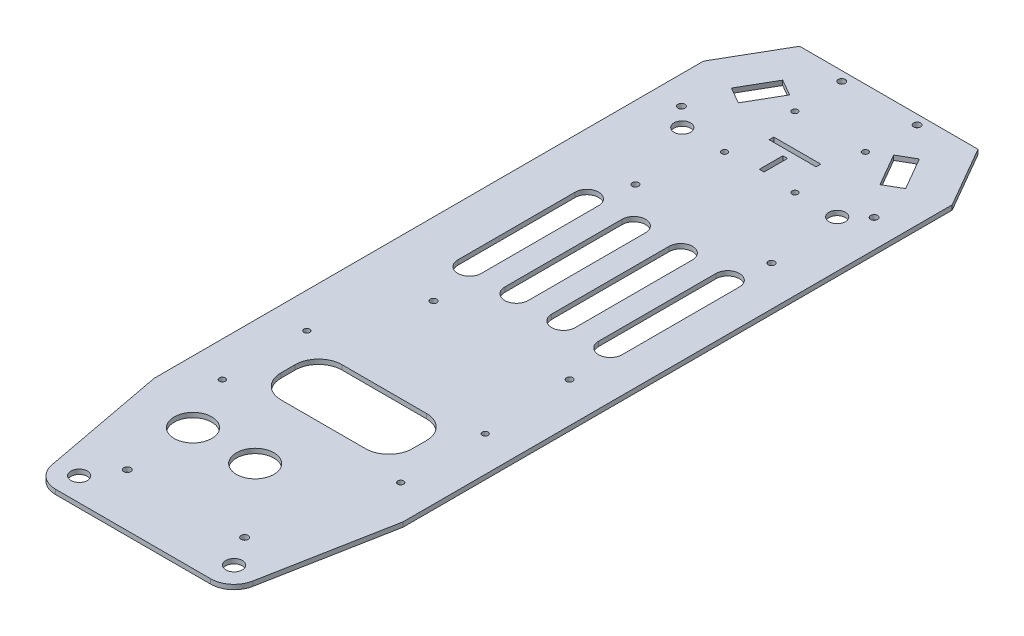
from build123d import *

# Parameters (mm, degrees)
ESQUISSE1_W              = 106
ESQUISSE1_H              = 332
ESQUISSE1_R              = 3.5
BOSS_EXTRU_1_DEPTH       = 2
ESQUISSE3_R              = 1.375
ENL_V_MAT_EXTRU_1_DEPTH  = 192.01112533
CHANFREIN1_SIZE          = 15
CHANFREIN1_SIZE2         = 25.980762114
ESQUISSE4_R              = 1.25
ESQUISSE4_W              = 56
ESQUISSE4_H              = 26
ENL_V_MAT_EXTRU_2_DEPTH  = 10
CONG_1_R                 = 10
ESQUISSE6_R              = 1.25
ESQUISSE6_W              = 20
ESQUISSE6_H              = 2
ESQUISSE6_W_2            = 2
ESQUISSE6_H_2            = 10
ENL_V_MAT_EXTRU_4_DEPTH  = 10
ESQUISSE7_R              = 8
ENL_V_MAT_EXTRU_5_DEPTH  = 10
ESQUISSE8_OUTSIDE_W      = 177.704
ESQUISSE8_OUTSIDE_H      = 403.704
ENL_V_MAT_EXTRU_6_DEPTH  = 10
ESQUISSE10_R             = 1.5
ENL_V_MAT_EXTRU_8_DEPTH  = 10
ESQUISSE11_R             = 1.5
ENL_V_MAT_EXTRU_9_DEPTH  = 10
ENL_V_MAT_EXTRU_10_DEPTH = 10


with BuildPart() as part:
    # Esquisse1 → Boss.-Extru.1 (new body)
    with BuildSketch(Plane(origin=(0, 0, 0), x_dir=(1, 0, 0), z_dir=(0, 1, 0))):
        with Locations((0, 17.5)):
            Rectangle(ESQUISSE1_W, ESQUISSE1_H)
        with Locations((-33, 128.5)):
            Circle(ESQUISSE1_R, mode=Mode.SUBTRACT)
        with Locations((-33, -128.5)):
            Circle(ESQUISSE1_R, mode=Mode.SUBTRACT)
        with Locations((33, 128.5)):
            Circle(ESQUISSE1_R, mode=Mode.SUBTRACT)
        with Locations((33, -128.5)):
            Circle(ESQUISSE1_R, mode=Mode.SUBTRACT)
    extrude(amount=BOSS_EXTRU_1_DEPTH)

    # Esquisse3 → Enlèv. mat.-Extru.1 (cut, through all)
    with BuildSketch(Plane(origin=(0, 2, 0), x_dir=(1, 0, 0), z_dir=(0, 1, 0))):
        with Locations((-22, 11.5)):
            Circle(ESQUISSE3_R)
        with Locations((-22, 97.5)):
            Circle(ESQUISSE3_R)
        with Locations((36, 97.5)):
            Circle(ESQUISSE3_R)
        with Locations((36, 11.5)):
            Circle(ESQUISSE3_R)
    extrude(amount=-ENL_V_MAT_EXTRU_1_DEPTH, mode=Mode.SUBTRACT)

    # Chanfrein1
    chanfrein1_edges = [part.edges().sort_by_distance(p)[0] for p in [
        (-53, 1, -183.5),
        (53, 1, -183.5),
    ]]
    chanfrein1_side = [part.faces().sort_by_distance(p)[0] for p in [
        (0, 1, -183.5),
    ]]
    chamfer(chanfrein1_edges, length=CHANFREIN1_SIZE, length2=CHANFREIN1_SIZE2, reference=chanfrein1_side[0])

    # Esquisse4 → Enlèv. mat.-Extru.2 (cut)
    with BuildSketch(Plane(origin=(0, 2, 0), x_dir=(1, 0, 0), z_dir=(0, 1, 0))):
        with Locations((38, -62.5)):
            Circle(ESQUISSE4_R)
        with Locations((38, -26.5)):
            Circle(ESQUISSE4_R)
        with Locations((-38, -62.5)):
            Circle(ESQUISSE4_R)
        with Locations((-38, -26.5)):
            Circle(ESQUISSE4_R)
        with Locations((0, -44.5)):
            Rectangle(ESQUISSE4_W, ESQUISSE4_H)
    extrude(amount=-ENL_V_MAT_EXTRU_2_DEPTH, mode=Mode.SUBTRACT)

    # Congé1
    cong_1_edges = [part.edges().sort_by_distance(p)[0] for p in [
        (28, 1, 57.5),
        (28, 1, 31.5),
        (-28, 1, 31.5),
        (-28, 1, 57.5),
    ]]
    fillet(cong_1_edges, radius=CONG_1_R)

    # Esquisse6 → Enlèv. mat.-Extru.4 (cut)
    with BuildSketch(Plane(origin=(0, 2, 0), x_dir=(1, 0, 0), z_dir=(0, 1, 0))):
        with Locations((-15, 128.5)):
            Circle(ESQUISSE6_R)
        with Locations((15, 128.5)):
            Circle(ESQUISSE6_R)
        with Locations((-15, 158.5)):
            Circle(ESQUISSE6_R)
        with Locations((15, 158.5)):
            Circle(ESQUISSE6_R)
        with Locations((0, 143.5)):
            Rectangle(ESQUISSE6_W, ESQUISSE6_H)
        with Locations((-0.179881847, 134.5)):
            Rectangle(ESQUISSE6_W_2, ESQUISSE6_H_2)
    extrude(amount=-ENL_V_MAT_EXTRU_4_DEPTH, mode=Mode.SUBTRACT)

    # Esquisse7 → Enlèv. mat.-Extru.5 (cut)
    with BuildSketch(Plane(origin=(0, 2, 0), x_dir=(1, 0, 0), z_dir=(0, 1, 0))):
        with Locations((0, -86.5)):
            Circle(ESQUISSE7_R)
        with Locations((-26.5, -86.5)):
            Circle(ESQUISSE7_R)
    extrude(amount=-ENL_V_MAT_EXTRU_5_DEPTH, mode=Mode.SUBTRACT)

    # Esquisse8 outside → Enlèv. mat.-Extru.6 (cut)
    with BuildSketch(Plane(origin=(0, 2, 0), x_dir=(1, 0, 0), z_dir=(0, 1, 0))):
        with Locations((0, 17.5)):
            Rectangle(ESQUISSE8_OUTSIDE_W, ESQUISSE8_OUTSIDE_H)
        with BuildLine():
            Line((38, 183.5), (-38, 183.5))
            Line((-38, 183.5), (-53, 157.519237886))
            Line((-53, 157.519237886), (-53, -76.5))
            Line((-53, -76.5), (-42.82620953, -130.356234435))
            ThreePointArc((-42.82620953, -130.356234435), (-39.381130607, -136.199426743), (-33, -138.5))
            Line((-33, -138.5), (33, -138.5))
            ThreePointArc((33, -138.5), (39.381130607, -136.199426743), (42.82620953, -130.356234435))
            Line((42.82620953, -130.356234435), (53, -76.5))
            Line((53, -76.5), (53, 157.519237886))
            Line((53, 157.519237886), (38, 183.5))
        make_face(mode=Mode.SUBTRACT)
    extrude(amount=-ENL_V_MAT_EXTRU_6_DEPTH, mode=Mode.SUBTRACT)

    # Esquisse10 → Enlèv. mat.-Extru.8 (cut)
    with BuildSketch(Plane.XZ):
        with Locations((16.063466521, -179.495190528)):
            Circle(ESQUISSE10_R)
        with Locations((41.063466521, -136.193920339)):
            Circle(ESQUISSE10_R)
        with Locations((-41.063466521, -136.193920339)):
            Circle(ESQUISSE10_R)
        with Locations((-16.063466521, -179.495190528)):
            Circle(ESQUISSE10_R)
        Polygon((32.563466521, -150.916352203), (30.18189666, -149.541352203), (26.186846942, -156.460981293), (22.18189666, -163.397758664), (24.563466521, -164.772758664), (29.11009989, -167.397758664), (37.11009989, -153.541352203), align=None)
        Polygon((-24.563466521, -164.772758664), (-22.18189666, -163.397758664), (-26.186846942, -156.460981293), (-30.18189666, -149.541352203), (-32.563466521, -150.916352203), (-37.11009989, -153.541352203), (-29.11009989, -167.397758664), align=None)
    extrude(amount=-ENL_V_MAT_EXTRU_8_DEPTH, mode=Mode.SUBTRACT)

    # Esquisse11 → Enlèv. mat.-Extru.9 (cut)
    with BuildSketch(Plane.XZ):
        with Locations((25, 116)):
            Circle(ESQUISSE11_R)
        with Locations((-25, 116)):
            Circle(ESQUISSE11_R)
    extrude(amount=-ENL_V_MAT_EXTRU_9_DEPTH, mode=Mode.SUBTRACT)

    # Esquisse12 → Enlèv. mat.-Extru.10 (cut)
    with BuildSketch(Plane.XZ):
        with BuildLine():
            Line((38, -31.843333074), (38, -81.843333074))
            ThreePointArc((38, -81.843333074), (33, -86.843333074), (28, -81.843333074))
            Line((28, -81.843333074), (28, -31.843333074))
            ThreePointArc((28, -31.843333074), (33, -26.843333074), (38, -31.843333074))
        make_face()
        with BuildLine():
            Line((18, -31.843333074), (18, -81.843333074))
            ThreePointArc((18, -81.843333074), (13, -86.843333074), (8, -81.843333074))
            Line((8, -81.843333074), (8, -31.843333074))
            ThreePointArc((8, -31.843333074), (13, -26.843333074), (18, -31.843333074))
        make_face()
        with BuildLine():
            Line((-2, -31.843333074), (-2, -81.843333074))
            ThreePointArc((-2, -81.843333074), (-7, -86.843333074), (-12, -81.843333074))
            Line((-12, -81.843333074), (-12, -31.843333074))
            ThreePointArc((-12, -31.843333074), (-7, -26.843333074), (-2, -31.843333074))
        make_face()
        with BuildLine():
            Line((-22, -31.843333074), (-22, -81.843333074))
            ThreePointArc((-22, -81.843333074), (-27, -86.843333074), (-32, -81.843333074))
            Line((-32, -81.843333074), (-32, -31.843333074))
            ThreePointArc((-32, -31.843333074), (-27, -26.843333074), (-22, -31.843333074))
        make_face()
    extrude(amount=-ENL_V_MAT_EXTRU_10_DEPTH, mode=Mode.SUBTRACT)


solid = part.part
